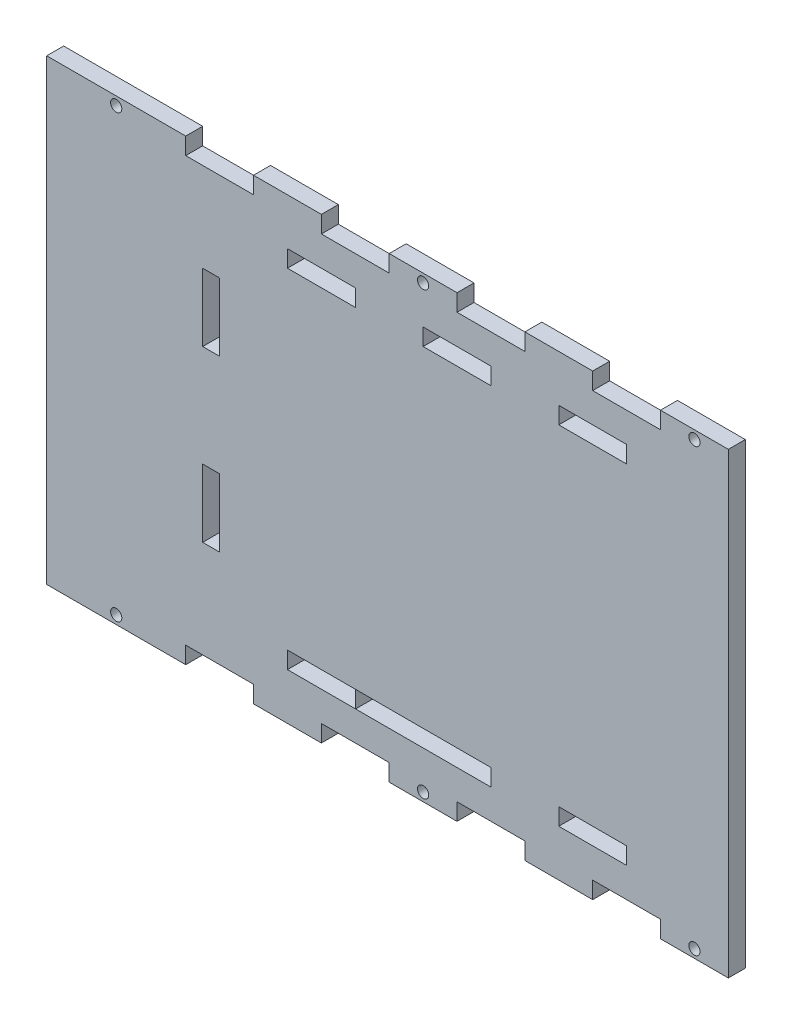
from build123d import *

# Parameters (mm, degrees)
SKETCH1_W           = 255.259874896
SKETCH1_H           = 171.45
BOSS_EXTRUDE1_DEPTH = 6.35
SKETCH2_W           = 25.4
SKETCH2_H           = 6.35
CUT_EXTRUDE1_DEPTH  = 6.35
LPATTERN1_COUNT     = 4
LPATTERN1_PITCH     = 50.8
SKETCH4_R           = 2.0955
CUT_EXTRUDE2_DEPTH  = 209.955242778
SKETCH5_W           = 25.4
SKETCH5_H           = 6.35
SKETCH5_W_2         = 50.690516307
SKETCH5_W_3         = 6.35
SKETCH5_H_2         = 25.4
CUT_EXTRUDE3_DEPTH  = 6.35


with BuildPart() as part:
    # Sketch1 → Boss-Extrude1 (new body)
    with BuildSketch(Plane.XY):
        with Locations((-11.719947229, 69.85)):
            Rectangle(SKETCH1_W, SKETCH1_H)
    extrude(amount=BOSS_EXTRUDE1_DEPTH)

    # Sketch2 → Cut-Extrude1 (cut)
    with BuildSketch(Plane.XY.offset(6.35)):
        with Locations((-74.590009781, -12.7)):
            Rectangle(SKETCH2_W, SKETCH2_H)
        with Locations((-74.590009781, 152.4)):
            Rectangle(SKETCH2_W, SKETCH2_H)
    cut_extrude1 = extrude(amount=-CUT_EXTRUDE1_DEPTH, mode=Mode.SUBTRACT)

    # LPattern1: Cut-Extrude1 ×4
    with Locations(*[(i * LPATTERN1_PITCH, 0, 0) for i in range(1, LPATTERN1_COUNT)]):
        add(cut_extrude1, mode=Mode.SUBTRACT)

    # Sketch4 → Cut-Extrude2 (cut, through all)
    with BuildSketch(Plane(origin=(0, 0, 0), x_dir=(-1, 0, 0), z_dir=(0, 0, -1))):
        with Locations((-103.209990219, -12.7)):
            Circle(SKETCH4_R)
        with Locations((-1.609990219, -12.7)):
            Circle(SKETCH4_R)
        with Locations((113.319947229, -12.7)):
            Circle(SKETCH4_R)
        with Locations((113.319947229, 152.4)):
            Circle(SKETCH4_R)
        with Locations((-1.609990219, 152.4)):
            Circle(SKETCH4_R)
        with Locations((-103.209990219, 152.4)):
            Circle(SKETCH4_R)
    extrude(amount=-CUT_EXTRUDE2_DEPTH, mode=Mode.SUBTRACT)

    # Sketch5 → Cut-Extrude3 (cut)
    with BuildSketch(Plane(origin=(0, 0, 0), x_dir=(-1, 0, 0), z_dir=(0, 0, -1))):
        with Locations((-65.109990219, 4.7625)):
            Rectangle(SKETCH5_W, SKETCH5_H)
        with Locations((-1.664732066, 4.7625)):
            Rectangle(SKETCH5_W_2, SKETCH5_H)
        with Locations((36.490009781, 4.7625)):
            Rectangle(SKETCH5_W, SKETCH5_H)
        with Locations((77.765009781, 39.6875)):
            Rectangle(SKETCH5_W_3, SKETCH5_H_2)
        with Locations((77.765009781, 103.1875)):
            Rectangle(SKETCH5_W_3, SKETCH5_H_2)
        with Locations((36.490009781, 134.9375)):
            Rectangle(SKETCH5_W, SKETCH5_H)
        with Locations((-14.309990219, 134.9375)):
            Rectangle(SKETCH5_W, SKETCH5_H)
        with Locations((-65.109990219, 134.9375)):
            Rectangle(SKETCH5_W, SKETCH5_H)
    extrude(amount=-CUT_EXTRUDE3_DEPTH, mode=Mode.SUBTRACT)


solid = part.part
